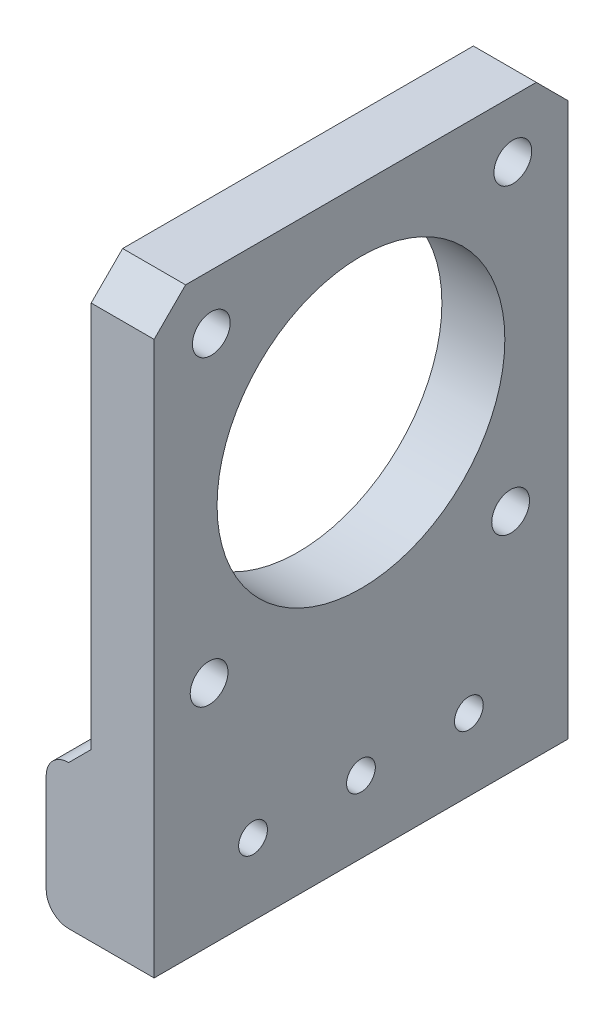
from build123d import *

# Parameters (mm, degrees)
SKETCH1_W                                           = 92.56
SKETCH1_H                                           = 46
BOSS_EXTRUDE1_DEPTH                                 = 6
SKETCH2_W                                           = 7
SKETCH2_H                                           = 46
BOSS_EXTRUDE2_DEPTH                                 = 54
SKETCH3_R                                           = 16
CUT_EXTRUDE1_DEPTH                                  = 120.512985069
SKETCH4_R                                           = 16
CUT_EXTRUDE2_DEPTH                                  = 117.616266447
F_4_2_4_2_DIAMETER_HOLE1_D                          = 4.2
F_4_2_4_2_DIAMETER_HOLE2_D                          = 4.2
CHAMFER1_SIZE                                       = 3.5
CHAMFER2_SIZE                                       = 6
BOSS_EXTRUDE3_DEPTH                                 = 46
FILLET1_R                                           = 2.5
CHAMFER3_SIZE                                       = 2.5
FILLET2_R                                           = 2.5
M3_CLEARANCE_HOLE1_D                                = 3.2
M3_CLEARANCE_HOLE1_DEPTH                            = 30
M3_CLEARANCE_HOLE1_TIP                              = 0.96137699
CSK_FOR_M3_COUNTERSUNK_FLAT_HEAD_SCREW2_D           = 3.6
CSK_FOR_M3_COUNTERSUNK_FLAT_HEAD_SCREW2_DEPTH       = 30
CSK_FOR_M3_COUNTERSUNK_FLAT_HEAD_SCREW2_CSINK_D     = 6.3
CSK_FOR_M3_COUNTERSUNK_FLAT_HEAD_SCREW2_CSINK_ANGLE = 90
CSK_FOR_M3_COUNTERSUNK_FLAT_HEAD_SCREW2_TIP         = 1.081549114
SKETCH18_W                                          = 2.5
SKETCH18_H                                          = 5.65
CUT_EXTRUDE4_DEPTH                                  = 121.623188484


with BuildPart() as part:
    # Sketch1 → Boss-Extrude1 (new body)
    with BuildSketch(Plane(origin=(0, 0, 0), x_dir=(1, 0, 0), z_dir=(0, 1, 0))):
        with Locations((46.28, 23)):
            Rectangle(SKETCH1_W, SKETCH1_H)
    extrude(amount=BOSS_EXTRUDE1_DEPTH)

    # Sketch2 → Boss-Extrude2 (add)
    with BuildSketch(Plane(origin=(0, 6, 0), x_dir=(1, 0, 0), z_dir=(0, 1, 0))):
        with Locations((89.06, 23)):
            Rectangle(SKETCH2_W, SKETCH2_H)
        with Locations((3.5, 23)):
            Rectangle(SKETCH2_W, SKETCH2_H)
    extrude(amount=BOSS_EXTRUDE2_DEPTH)

    # Sketch3 → Cut-Extrude1 (cut, through all)
    with BuildSketch(Plane(origin=(92.56, 0, 0), x_dir=(0, 0, -1), z_dir=(1, 0, 0))):
        with Locations((23, 37)):
            Circle(SKETCH3_R)
    extrude(amount=-CUT_EXTRUDE1_DEPTH, mode=Mode.SUBTRACT)

    # Sketch4 → Cut-Extrude2 (cut, through all)
    with BuildSketch(Plane(origin=(0, 6, 0), x_dir=(1, 0, 0), z_dir=(0, 1, 0))):
        with Locations(Location((46.28, 23, 0), (0, 0, 270))):
            Circle(SKETCH4_R)
    extrude(amount=-CUT_EXTRUDE2_DEPTH, mode=Mode.SUBTRACT)

    # Ø4.2 (4.2) Diameter Hole1 (through all)
    with Locations(Plane(origin=(0, 0, 0), x_dir=(-1, 0, 0), z_dir=(0, -1, 0))):
        with Locations((-63.165621688, 39.642079068), (-29.637920932, 39.885621688), (-29.394378312, 6.357920932), (-62.922079068, 6.114378312)):
            Hole(F_4_2_4_2_DIAMETER_HOLE1_D / 2)

    # Ø4.2 (4.2) Diameter Hole2 (through all)
    with Locations(Plane.ZY):
        with Locations((-39.885621688, 53.642079068), (-6.357920932, 53.885621688), (-6.114378312, 20.357920932), (-39.642079068, 20.114378312)):
            Hole(F_4_2_4_2_DIAMETER_HOLE2_D / 2)

    # Chamfer1
    chamfer1_edges = [part.edges().sort_by_distance(p)[0] for p in [
        (89.06, 60, -46),
        (89.06, 60, 0),
        (3.5, 60, 0),
        (3.5, 60, -46),
    ]]
    chamfer(chamfer1_edges, length=CHAMFER1_SIZE)

    # Chamfer2
    chamfer2_edges = [part.edges().sort_by_distance(p)[0] for p in [
        (85.56, 6, -23),
        (7, 6, -23),
    ]]
    chamfer(chamfer2_edges, length=CHAMFER2_SIZE)

    # Sketch10 → Boss-Extrude3 (add)
    with BuildSketch(Plane(origin=(0, 0, -46), x_dir=(-1, 0, 0), z_dir=(0, 0, -1))):
        Polygon((0, 11), (5, 11), (5, -5), (-11, -5), (-11, 0), (0, 0), align=None)
        Polygon((-81.56, 0), (-92.56, 0), (-92.56, 11), (-97.56, 11), (-97.56, -5), (-81.56, -5), align=None)
    extrude(amount=-BOSS_EXTRUDE3_DEPTH)

    # Fillet1
    fillet1_edges = [part.edges().sort_by_distance(p)[0] for p in [
        (-5, 11, -23),
        (11, -5, -23),
        (81.56, -5, -23),
        (97.56, 11, -23),
    ]]
    fillet(fillet1_edges, radius=FILLET1_R)

    # Chamfer3
    chamfer3_edges = [part.edges().sort_by_distance(p)[0] for p in [
        (92.56, 11, -23),
        (81.56, 0, -23),
        (11, 0, -23),
        (0, 11, -23),
    ]]
    chamfer(chamfer3_edges, length=CHAMFER3_SIZE - 0.0001)  # a hair under: the kernel refuses the full size

    # Fillet2
    fillet2_edges = [part.edges().sort_by_distance(p)[0] for p in [
        (-5, -5, -23),
        (97.56, -5, -23),
    ]]
    fillet(fillet2_edges, radius=FILLET2_R)

    # M3 Clearance Hole1
    with Locations(Plane.ZY.offset(5)):
        with Locations((-11, 3), (-23, 3), (-35, 3)):
            Hole(M3_CLEARANCE_HOLE1_D / 2, depth=M3_CLEARANCE_HOLE1_DEPTH)
            with Locations((0, 0, -(M3_CLEARANCE_HOLE1_DEPTH + M3_CLEARANCE_HOLE1_TIP / 2))):  # 118° drill point
                Cone(0, M3_CLEARANCE_HOLE1_D / 2, M3_CLEARANCE_HOLE1_TIP, mode=Mode.SUBTRACT)

    # CSK for M3 Countersunk Flat Head Screw2
    with Locations(Plane(origin=(97.56, 0, 0), x_dir=(0, 0, -1), z_dir=(1, 0, 0))):
        with Locations((11, 3), (23, 3), (35, 3)):
            CounterSinkHole(CSK_FOR_M3_COUNTERSUNK_FLAT_HEAD_SCREW2_D / 2, CSK_FOR_M3_COUNTERSUNK_FLAT_HEAD_SCREW2_CSINK_D / 2, depth=CSK_FOR_M3_COUNTERSUNK_FLAT_HEAD_SCREW2_DEPTH, counter_sink_angle=CSK_FOR_M3_COUNTERSUNK_FLAT_HEAD_SCREW2_CSINK_ANGLE)
            with Locations((0, 0, -(CSK_FOR_M3_COUNTERSUNK_FLAT_HEAD_SCREW2_DEPTH + CSK_FOR_M3_COUNTERSUNK_FLAT_HEAD_SCREW2_TIP / 2))):  # 118° drill point
                Cone(0, CSK_FOR_M3_COUNTERSUNK_FLAT_HEAD_SCREW2_D / 2, CSK_FOR_M3_COUNTERSUNK_FLAT_HEAD_SCREW2_TIP, mode=Mode.SUBTRACT)

    # Sketch18 → Cut-Extrude4 (cut, through all)
    with BuildSketch(Plane(origin=(0, 6, 0), x_dir=(1, 0, 0), z_dir=(0, 1, 0))):
        with Locations((22, 23)):
            Rectangle(SKETCH18_W, SKETCH18_H)
        with Locations((22, 35)):
            Rectangle(SKETCH18_W, SKETCH18_H)
        with Locations((22, 11)):
            Rectangle(SKETCH18_W, SKETCH18_H)
    cut_extrude4 = extrude(amount=-CUT_EXTRUDE4_DEPTH, mode=Mode.SUBTRACT)

    # Mirror1: Cut-Extrude4 across plane
    add(cut_extrude4.mirror(Plane.ZY.offset(-46.28)), mode=Mode.SUBTRACT)

    # SurfaceCut3
    split(bisect_by=Plane(origin=(7, 0, 0), x_dir=(0, 0, -1), z_dir=(1, 0, 0)), keep=Keep.BOTTOM)


solid = part.part
